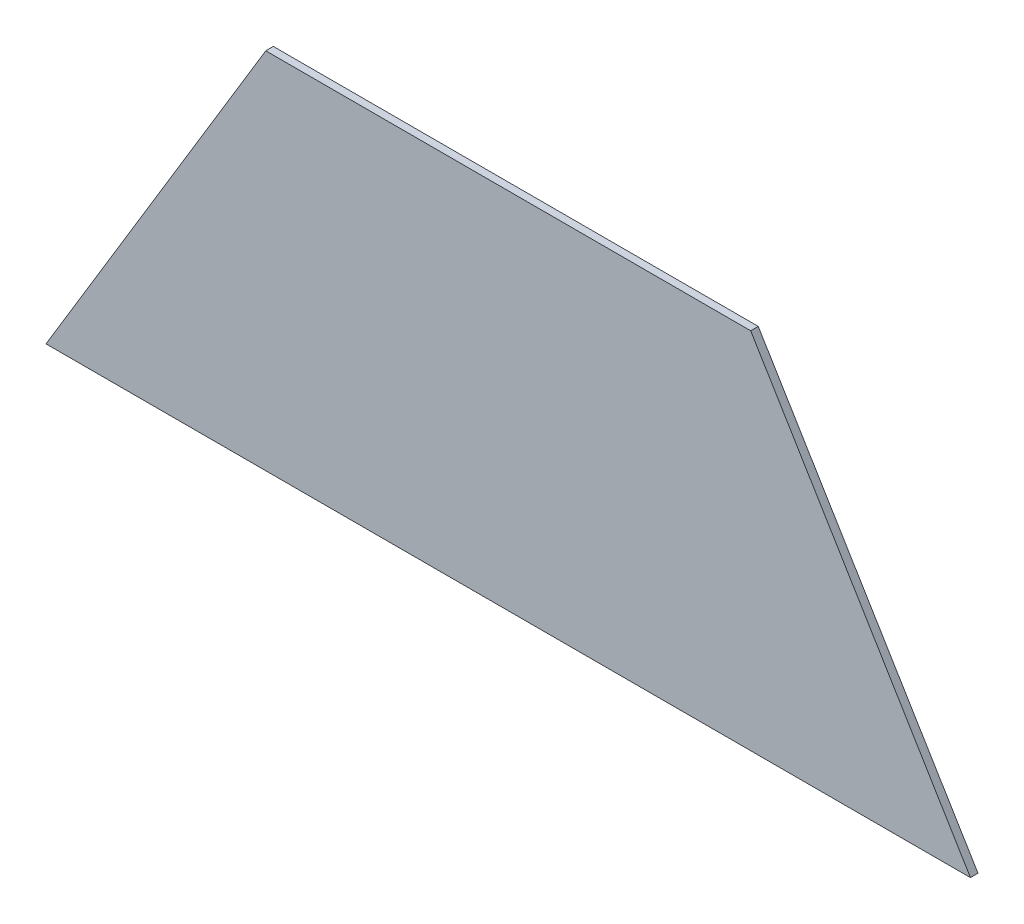
from build123d import *

# Parameters (mm, degrees)
EXTRUDE1_DEPTH = 1.5875


with BuildPart() as part:
    # Sketch1 → Extrude1 (new, symmetric)
    with BuildSketch(Plane.XY):
        Polygon((0, 0), (193.675, 0), (101.6, 152.4), (0, 152.4), (-101.6, 152.4), (-193.675, 0), align=None)
    extrude(amount=EXTRUDE1_DEPTH, both=True)


solid = part.part
